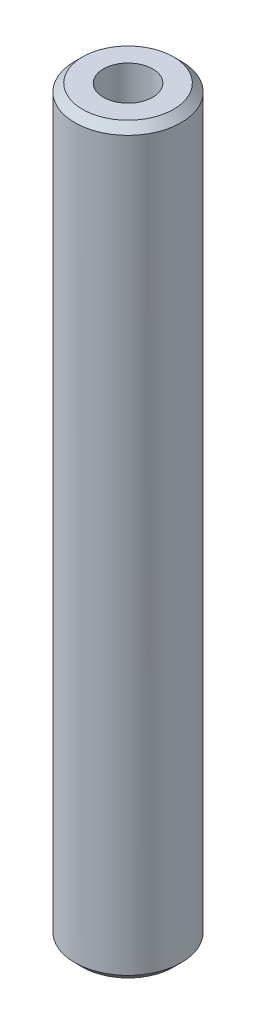
from build123d import *

# Parameters (mm, degrees)
SKETCH1_R           = 5
BOSS_EXTRUDE1_DEPTH = 69.844634287
SKETCH2_R           = 2.31579115
CUT_EXTRUDE1_DEPTH  = 71.201659088
CHAMFER1_SIZE       = 0.72256201


with BuildPart() as part:
    # Sketch1 → Boss-Extrude1 (new body)
    with BuildSketch(Plane(origin=(0, 0, 0), x_dir=(1, 0, 0), z_dir=(0, 1, 0))):
        Circle(SKETCH1_R)
    extrude(amount=BOSS_EXTRUDE1_DEPTH)

    # Sketch2 → Cut-Extrude1 (cut, through all)
    with BuildSketch(Plane(origin=(0, 0, 0), x_dir=(1, 0, 0), z_dir=(0, 1, 0))):
        Circle(SKETCH2_R)
    extrude(amount=CUT_EXTRUDE1_DEPTH, mode=Mode.SUBTRACT)

    # Chamfer1
    chamfer1_edges = [part.edges().sort_by_distance(p)[0] for p in [
        (-5, 69.844634287, 0),
        (-5, 0, 0),
    ]]
    chamfer(chamfer1_edges, length=CHAMFER1_SIZE)


solid = part.part
